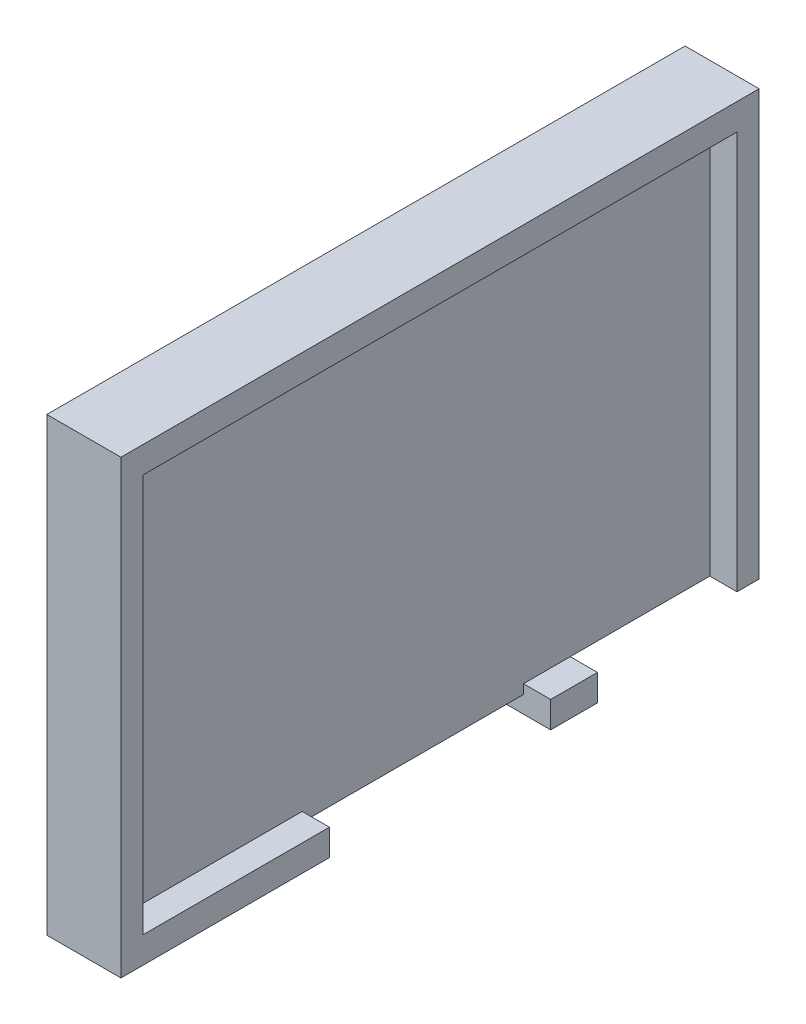
from build123d import *

# Parameters (mm, degrees)
SKETCH1_W           = 26.5
SKETCH1_H           = 37.5
BOSS_EXTRUDE1_DEPTH = 4.353
SKETCH2_W           = 23.4
SKETCH2_H           = 34.9
CUT_EXTRUDE1_DEPTH  = 1.6
SKETCH3_W           = 1.55
SKETCH3_H           = 13
CUT_EXTRUDE2_DEPTH  = 1.6
SKETCH4_W           = 2.753
SKETCH4_H           = 13
CUT_EXTRUDE3_DEPTH  = 1
SKETCH5_W           = 1.55
SKETCH5_H           = 9.5
CUT_EXTRUDE5_DEPTH  = 1.6
CUT_EXTRUDE6_DEPTH  = 9.5


with BuildPart() as part:
    # Sketch1 → Boss-Extrude1 (new body)
    with BuildSketch(Plane.YZ):
        with Locations((57.87, 107.93)):
            Rectangle(SKETCH1_W, SKETCH1_H)
    extrude(amount=BOSS_EXTRUDE1_DEPTH)

    # Sketch2 → Cut-Extrude1 (cut)
    with BuildSketch(Plane.YZ.offset(4.353)):
        with Locations((57.87, 107.93)):
            Rectangle(SKETCH2_W, SKETCH2_H)
    extrude(amount=-CUT_EXTRUDE1_DEPTH, mode=Mode.SUBTRACT)

    # Sketch3 → Cut-Extrude2 (cut)
    with BuildSketch(Plane.YZ.offset(4.353)):
        with Locations((45.395, 107.93)):
            Rectangle(SKETCH3_W, SKETCH3_H)
    extrude(amount=-CUT_EXTRUDE2_DEPTH, mode=Mode.SUBTRACT)

    # Sketch4 → Cut-Extrude3 (cut)
    with BuildSketch(Plane.XZ.offset(-44.62)):
        with Locations((1.3765, 107.93)):
            Rectangle(SKETCH4_W, SKETCH4_H)
    extrude(amount=-CUT_EXTRUDE3_DEPTH, mode=Mode.SUBTRACT)

    # Sketch5 → Cut-Extrude5 (cut)
    with BuildSketch(Plane.YZ.offset(4.353)):
        with Locations((45.395, 93.93)):
            Rectangle(SKETCH5_W, SKETCH5_H)
    extrude(amount=-CUT_EXTRUDE5_DEPTH, mode=Mode.SUBTRACT)

    # Sketch6 → Cut-Extrude6 (cut)
    with BuildSketch(Plane(origin=(0, 0, 89.18), x_dir=(1, 0, 0), z_dir=(0, 0, -1))):
        Polygon((1.953, -46.17), (2.753, -46.17), (2.753, -44.62), (0, -44.62), (0, -49.12), (1.953, -49.12), align=None)
    extrude(amount=-CUT_EXTRUDE6_DEPTH, mode=Mode.SUBTRACT)


solid = part.part
